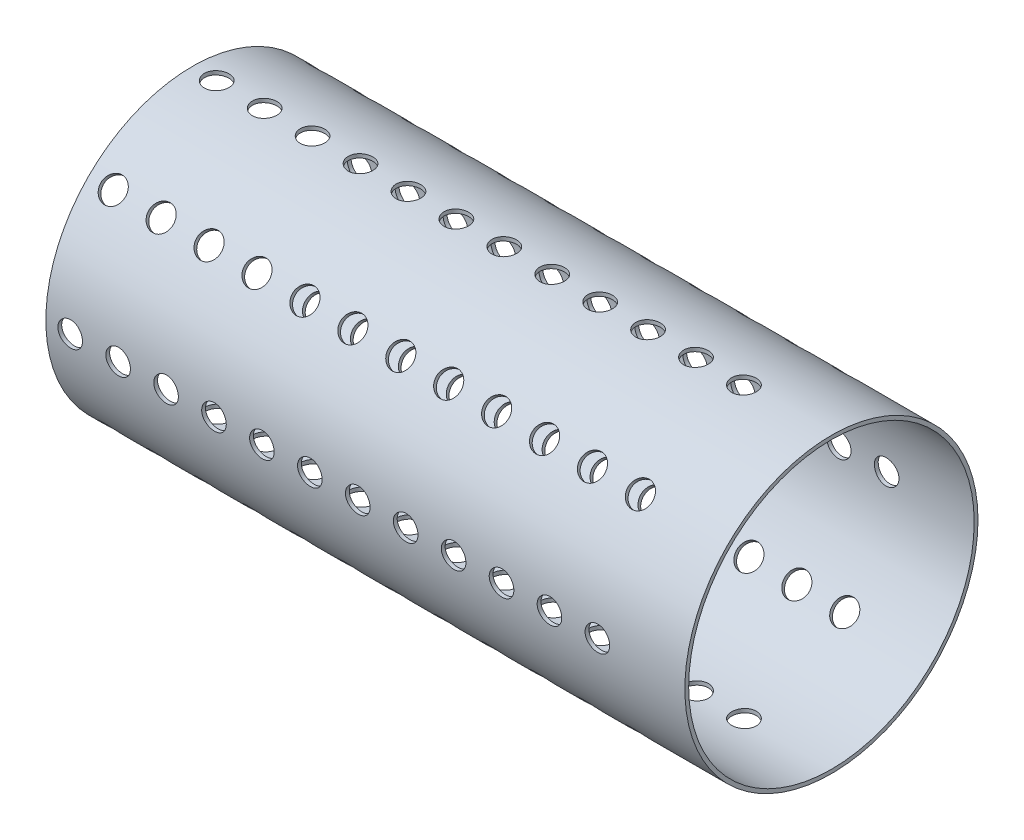
from build123d import *

# Parameters (mm, degrees)
SKETCH1_R           = 23.3045
SKETCH1_R_2         = 22.69744
BOSS_EXTRUDE1_DEPTH = 101.6
SKETCH2_R           = 1.956355472
CUT_EXTRUDE1_DEPTH  = 107.811794482
CIRPATTERN1_COUNT   = 8


with BuildPart() as part:
    # Sketch1 → Boss-Extrude1 (new body)
    with BuildSketch(Plane(origin=(0, 0, 0), x_dir=(0, 0, -1), z_dir=(1, 0, 0))):
        Circle(SKETCH1_R)
        Circle(SKETCH1_R_2, mode=Mode.SUBTRACT)
    extrude(amount=BOSS_EXTRUDE1_DEPTH)

    # Sketch2 → Cut-Extrude1 (cut, symmetric)
    with BuildSketch(Plane.XY):
        with Locations((3.870323468, 0)):
            Circle(SKETCH2_R)
        with Locations((11.490323468, 0)):
            Circle(SKETCH2_R)
        with Locations((19.110323468, 0)):
            Circle(SKETCH2_R)
        with Locations((26.730323468, 0)):
            Circle(SKETCH2_R)
        with Locations((34.350323468, 0)):
            Circle(SKETCH2_R)
        with Locations((41.970323468, 0)):
            Circle(SKETCH2_R)
        with Locations((49.590323468, 0)):
            Circle(SKETCH2_R)
        with Locations((57.210323468, 0)):
            Circle(SKETCH2_R)
        with Locations((64.830323468, 0)):
            Circle(SKETCH2_R)
        with Locations((72.450323468, 0)):
            Circle(SKETCH2_R)
        with Locations((80.070323468, 0)):
            Circle(SKETCH2_R)
        with Locations((87.690323468, 0)):
            Circle(SKETCH2_R)
    cut_extrude1 = extrude(amount=CUT_EXTRUDE1_DEPTH, both=True, mode=Mode.SUBTRACT)

    # CirPattern1: Cut-Extrude1 ×8 about axis
    cirpattern1_axis = Axis((4.646822769, 0, 0), (1, 0, 0))
    for i in range(1, CIRPATTERN1_COUNT):
        add(cut_extrude1.rotate(cirpattern1_axis, i * 360 / CIRPATTERN1_COUNT), mode=Mode.SUBTRACT)


solid = part.part
